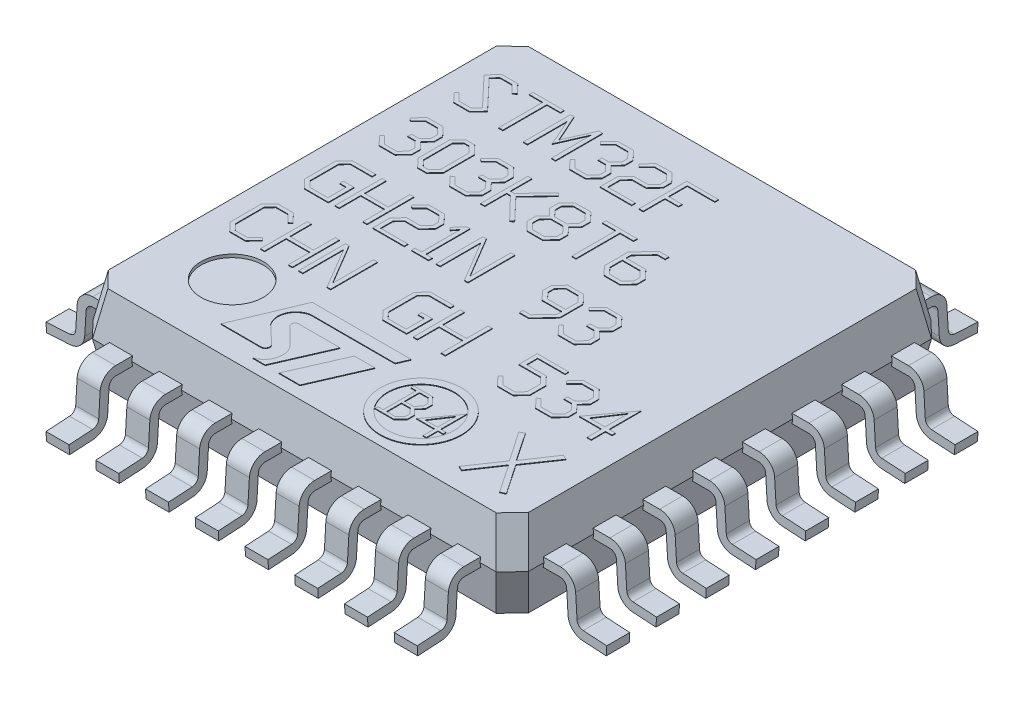
from build123d import *
from OCP.BRepFilletAPI import BRepFilletAPI_MakeChamfer

# Parameters (mm, degrees)
SKETCH1_W                  = 7
SKETCH1_H                  = 7
BOSS_EXTRUDE1_DEPTH        = 1.4
CHAMFER1_SIZE              = 0.7
CHAMFER1_SIZE_2            = 0.123428886
BOSS_EXTRUDE2_DEPTH        = 0.185
BOSS_EXTRUDE2_DEPTH_BACK   = 0.185
CHAMFER2_SIZE              = 0.25
CHAMFER2_SIZE2             = 0.257893718
FILLET2_R                  = 0.25
FILLET3_R                  = 0.105
LPATTERN2_COUNT            = 8
LPATTERN2_PITCH            = 0.8
SKETCH6_R                  = 0.5
PIN_1_IDENTIFICATION_DEPTH = 0.05
MARKINGS_1_DEPTH           = 0.01
MARKINGS_1_2_DEPTH         = 0.01
MARKINGS_1_3_DEPTH         = 0.01
MARKINGS_1_4_DEPTH         = 0.01
MARKINGS_1_5_DEPTH         = 0.01
MARKINGS_1_6_DEPTH         = 0.01
MARKINGS_1_7_DEPTH         = 0.01
MARKINGS_1_8_DEPTH         = 0.01
MARKINGS_1_9_DEPTH         = 0.01
MARKINGS_1_10_DEPTH        = 0.01
MARKINGS_1_11_DEPTH        = 0.01
MARKINGS_1_12_DEPTH        = 0.01
MARKINGS_1_13_DEPTH        = 0.01
MARKINGS_1_14_DEPTH        = 0.01
MARKINGS_1_15_DEPTH        = 0.01
MARKINGS_1_16_DEPTH        = 0.01
MARKINGS_1_17_DEPTH        = 0.01
MARKINGS_1_18_DEPTH        = 0.01
MARKINGS_1_19_DEPTH        = 0.01
MARKINGS_1_20_DEPTH        = 0.01
MARKINGS_1_21_DEPTH        = 0.01
MARKINGS_1_22_DEPTH        = 0.01
MARKINGS_1_23_DEPTH        = 0.01
MARKINGS_1_24_DEPTH        = 0.01
MARKINGS_1_25_DEPTH        = 0.01
MARKINGS_1_26_DEPTH        = 0.01
MARKINGS_1_27_DEPTH        = 0.01
MARKINGS_1_28_DEPTH        = 0.01
MARKINGS_2_DEPTH           = 0.01
MARKINGS_2_2_DEPTH         = 0.01
MARKINGS_2_3_DEPTH         = 0.01
MARKINGS_3_DEPTH           = 0.01
MARKINGS_3_2_DEPTH         = 0.01
SKETCH11_R                 = 0.653338309
SKETCH11_R_2               = 0.534659599
MARKINGS_4_DEPTH           = 0.01
MARKINGS_5_DEPTH           = 0.01


with BuildPart() as part:
    # Sketch1 → Boss-Extrude1 (new body)
    with BuildSketch(Plane(origin=(0, 0, 0), x_dir=(1, 0, 0), z_dir=(0, 1, 0))):
        with Locations((3.5, 3.5)):
            Rectangle(SKETCH1_W, SKETCH1_H)
    extrude(amount=BOSS_EXTRUDE1_DEPTH)

    # Chamfer1
    # the kernel refuses this chamfer: 0.7, 0.123428886 mm, written as the material it takes off along each edge
    with BuildSketch(Plane(origin=(8.818977157, 0, -7), x_dir=(0, 0.9999776716360547, -0.006682531656101123), z_dir=(-1, 0, 0)), Plane(origin=(0, 0, -8.818977157), x_dir=(-0.006682531656101709, 0.9999776716360547, 0), z_dir=(0, 0, 1)), Plane(origin=(-1.818977157, 0, 0), x_dir=(0, 0.9999776716360547, 0.006682531656101709), z_dir=(1, 0, 0)), Plane(origin=(7, 0, 1.818977157), x_dir=(0.006682531656101123, 0.9999776716360547, 0), z_dir=(0, 0, -1))) as chamfer1_piece_1:
        Polygon((CHAMFER1_SIZE * 0.999977671636, -CHAMFER1_SIZE * 0.0066825316561), (-CHAMFER1_SIZE_2 * 0.00668253168295, -CHAMFER1_SIZE_2 * 0.999977675654), (0, 0), align=None)
    extrude(amount=10.637954315, mode=Mode.SUBTRACT)
    with BuildSketch(Plane(origin=(8.818977157, 1.4, -7), x_dir=(0, -0.9999776716360547, -0.006682531656101123), z_dir=(-1, 0, 0)), Plane(origin=(0, 1.4, -8.818977157), x_dir=(-0.006682531656101709, -0.9999776716360547, 0), z_dir=(0, 0, 1)), Plane(origin=(-1.818977157, 1.4, 0), x_dir=(0, -0.9999776716360547, 0.006682531656101709), z_dir=(1, 0, 0)), Plane(origin=(7, 1.4, 1.818977157), x_dir=(0.006682531656101123, -0.9999776716360547, 0), z_dir=(0, 0, -1))) as chamfer1_piece_2:
        Polygon((CHAMFER1_SIZE * 0.999977671636, CHAMFER1_SIZE * 0.0066825316561), (-CHAMFER1_SIZE_2 * 0.00668253168295, CHAMFER1_SIZE_2 * 0.999977675654), (0, 0), align=None)
    extrude(amount=10.637954315, mode=Mode.SUBTRACT)

    # Chamfer2: one chamfer whose edges measure the first distance from different faces: ONE call of the kernel's chamfer builder (chamfer() names one face for all edges)
    chamfer2_edges_1 = [part.edges().sort_by_distance(p)[0] for p in [
        (6.938285557, 1.05, -0.061714443),
        (0.061714443, 1.05, -0.061714443),
    ]]
    chamfer2_side_1 = [part.faces().sort_by_distance(p)[0] for p in [
        (3.5, 1.047905928, -0.061345202),
    ]]
    chamfer2_edges_2 = [part.edges().sort_by_distance(p)[0] for p in [
        (6.938285557, 0.35, -0.061714443),
        (0.061714443, 0.35, -0.061714443),
    ]]
    chamfer2_side_2 = [part.faces().sort_by_distance(p)[0] for p in [
        (3.5, 0.352094072, -0.061345202),
    ]]
    chamfer2_edges_3 = [part.edges().sort_by_distance(p)[0] for p in [
        (6.938285557, 1.05, -6.938285557),
    ]]
    chamfer2_side_3 = [part.faces().sort_by_distance(p)[0] for p in [
        (6.938654798, 1.047905928, -3.5),
    ]]
    chamfer2_edges_4 = [part.edges().sort_by_distance(p)[0] for p in [
        (0.061714443, 1.05, -6.938285557),
    ]]
    chamfer2_side_4 = [part.faces().sort_by_distance(p)[0] for p in [
        (0.061345202, 1.047905928, -3.5),
    ]]
    chamfer2_edges_5 = [part.edges().sort_by_distance(p)[0] for p in [
        (6.938285557, 0.35, -6.938285557),
    ]]
    chamfer2_side_5 = [part.faces().sort_by_distance(p)[0] for p in [
        (6.938654798, 0.352094072, -3.5),
    ]]
    chamfer2_edges_6 = [part.edges().sort_by_distance(p)[0] for p in [
        (0.061714443, 0.35, -6.938285557),
    ]]
    chamfer2_side_6 = [part.faces().sort_by_distance(p)[0] for p in [
        (0.061345202, 0.352094072, -3.5),
    ]]
    chamfer2 = BRepFilletAPI_MakeChamfer(part.part.solid().wrapped)
    for e in chamfer2_edges_1:
        chamfer2.Add(CHAMFER2_SIZE, CHAMFER2_SIZE2, e.wrapped, chamfer2_side_1[0].wrapped)  # the first distance lies on this face
    for e in chamfer2_edges_2:
        chamfer2.Add(CHAMFER2_SIZE, CHAMFER2_SIZE2, e.wrapped, chamfer2_side_2[0].wrapped)  # the first distance lies on this face
    for e in chamfer2_edges_3:
        chamfer2.Add(CHAMFER2_SIZE, CHAMFER2_SIZE2, e.wrapped, chamfer2_side_3[0].wrapped)  # the first distance lies on this face
    for e in chamfer2_edges_4:
        chamfer2.Add(CHAMFER2_SIZE, CHAMFER2_SIZE2, e.wrapped, chamfer2_side_4[0].wrapped)  # the first distance lies on this face
    for e in chamfer2_edges_5:
        chamfer2.Add(CHAMFER2_SIZE, CHAMFER2_SIZE2, e.wrapped, chamfer2_side_5[0].wrapped)  # the first distance lies on this face
    for e in chamfer2_edges_6:
        chamfer2.Add(CHAMFER2_SIZE, CHAMFER2_SIZE2, e.wrapped, chamfer2_side_6[0].wrapped)  # the first distance lies on this face
    add(Compound.cast(chamfer2.Shape()), mode=Mode.REPLACE)

    # Sketch6 → Pin 1 Identification (cut)
    with BuildSketch(Plane(origin=(0, 1.4, 0), x_dir=(1, 0, 0), z_dir=(0, 1, 0))):
        with Locations(Location((1.25, 1.25, 0), (0, 0, 270))):
            Circle(SKETCH6_R)
    extrude(amount=-PIN_1_IDENTIFICATION_DEPTH, mode=Mode.SUBTRACT)


with BuildPart() as body_2:
    # Sketch4 → Boss-Extrude2 (new, two sides: drawn at the far end of the back side and taken through both)
    with BuildSketch(Plane.XY.offset(-0.7).offset(-BOSS_EXTRUDE2_DEPTH_BACK)):
        Polygon((6.987216294, 0.7725), (7.494151093, 0.7725), (7.536897924, 0.073595496), (8.008852038, 0.044729546), (8, -0.1), (7.4, -0.063302428), (7.357748714, 0.6275), (6.987216294, 0.6275), (7, 0.7), align=None)
    extrude(amount=BOSS_EXTRUDE2_DEPTH + BOSS_EXTRUDE2_DEPTH_BACK)

    # Fillet2
    fillet2_edges = [body_2.edges().sort_by_distance(p)[0] for p in [
        (7.494151093, 0.7725, -0.7),
        (7.4, -0.063302428, -0.7),
    ]]
    fillet(fillet2_edges, radius=FILLET2_R)

    # Fillet3
    fillet3_edges = [body_2.edges().sort_by_distance(p)[0] for p in [
        (7.536897924, 0.073595496, -0.7),
        (7.357748714, 0.6275, -0.7),
    ]]
    fillet(fillet3_edges, radius=FILLET3_R)


with BuildPart() as lpattern2_1:
    # LPattern2: pattern copy
    add(body_2.part.moved(Location(Vector(0, 0, -1) * (1 * LPATTERN2_PITCH))))


with BuildPart() as lpattern2_2:
    # LPattern2: pattern copy
    add(body_2.part.moved(Location(Vector(0, 0, -1) * (2 * LPATTERN2_PITCH))))


with BuildPart() as lpattern2_3:
    # LPattern2: pattern copy
    add(body_2.part.moved(Location(Vector(0, 0, -1) * (3 * LPATTERN2_PITCH))))


with BuildPart() as lpattern2_4:
    # LPattern2: pattern copy
    add(body_2.part.moved(Location(Vector(0, 0, -1) * (4 * LPATTERN2_PITCH))))


with BuildPart() as lpattern2_5:
    # LPattern2: pattern copy
    add(body_2.part.moved(Location(Vector(0, 0, -1) * (5 * LPATTERN2_PITCH))))


with BuildPart() as lpattern2_6:
    # LPattern2: pattern copy
    add(body_2.part.moved(Location(Vector(0, 0, -1) * (6 * LPATTERN2_PITCH))))


with BuildPart() as lpattern2_7:
    # LPattern2: pattern copy
    add(body_2.part.moved(Location(Vector(0, 0, -1) * (7 * LPATTERN2_PITCH))))


with BuildPart() as body_10:
    # Mirror1: mirrored copy
    add(body_2.part.mirror(Plane(origin=(0, 0, 0), x_dir=(-0.7071067811865477, 0, 0.7071067811865474), z_dir=(0.7071067811865476, 0, 0.7071067811865476))))


with BuildPart() as body_11:
    # Mirror1 2: mirrored copy
    add(lpattern2_1.part.mirror(Plane(origin=(0, 0, 0), x_dir=(-0.7071067811865477, 0, 0.7071067811865474), z_dir=(0.7071067811865476, 0, 0.7071067811865476))))


with BuildPart() as body_12:
    # Mirror1 3: mirrored copy
    add(lpattern2_2.part.mirror(Plane(origin=(0, 0, 0), x_dir=(-0.7071067811865477, 0, 0.7071067811865474), z_dir=(0.7071067811865476, 0, 0.7071067811865476))))


with BuildPart() as body_13:
    # Mirror1 4: mirrored copy
    add(lpattern2_3.part.mirror(Plane(origin=(0, 0, 0), x_dir=(-0.7071067811865477, 0, 0.7071067811865474), z_dir=(0.7071067811865476, 0, 0.7071067811865476))))


with BuildPart() as body_14:
    # Mirror1 5: mirrored copy
    add(lpattern2_4.part.mirror(Plane(origin=(0, 0, 0), x_dir=(-0.7071067811865477, 0, 0.7071067811865474), z_dir=(0.7071067811865476, 0, 0.7071067811865476))))


with BuildPart() as body_15:
    # Mirror1 6: mirrored copy
    add(lpattern2_5.part.mirror(Plane(origin=(0, 0, 0), x_dir=(-0.7071067811865477, 0, 0.7071067811865474), z_dir=(0.7071067811865476, 0, 0.7071067811865476))))


with BuildPart() as body_16:
    # Mirror1 7: mirrored copy
    add(lpattern2_6.part.mirror(Plane(origin=(0, 0, 0), x_dir=(-0.7071067811865477, 0, 0.7071067811865474), z_dir=(0.7071067811865476, 0, 0.7071067811865476))))


with BuildPart() as body_17:
    # Mirror1 8: mirrored copy
    add(lpattern2_7.part.mirror(Plane(origin=(0, 0, 0), x_dir=(-0.7071067811865477, 0, 0.7071067811865474), z_dir=(0.7071067811865476, 0, 0.7071067811865476))))


with BuildPart() as body_18:
    # Mirror2: mirrored copy
    add(body_2.part.mirror(Plane(origin=(3.5, 0, -3.5), x_dir=(0.7071067811865478, 0, 0.7071067811865472), z_dir=(0.7071067811865475, 0, -0.7071067811865477))))


with BuildPart() as body_19:
    # Mirror2 2: mirrored copy
    add(lpattern2_1.part.mirror(Plane(origin=(3.5, 0, -3.5), x_dir=(0.7071067811865478, 0, 0.7071067811865472), z_dir=(0.7071067811865475, 0, -0.7071067811865477))))


with BuildPart() as body_20:
    # Mirror2 3: mirrored copy
    add(lpattern2_2.part.mirror(Plane(origin=(3.5, 0, -3.5), x_dir=(0.7071067811865478, 0, 0.7071067811865472), z_dir=(0.7071067811865475, 0, -0.7071067811865477))))


with BuildPart() as body_21:
    # Mirror2 4: mirrored copy
    add(lpattern2_3.part.mirror(Plane(origin=(3.5, 0, -3.5), x_dir=(0.7071067811865478, 0, 0.7071067811865472), z_dir=(0.7071067811865475, 0, -0.7071067811865477))))


with BuildPart() as body_22:
    # Mirror2 5: mirrored copy
    add(lpattern2_4.part.mirror(Plane(origin=(3.5, 0, -3.5), x_dir=(0.7071067811865478, 0, 0.7071067811865472), z_dir=(0.7071067811865475, 0, -0.7071067811865477))))


with BuildPart() as body_23:
    # Mirror2 6: mirrored copy
    add(lpattern2_5.part.mirror(Plane(origin=(3.5, 0, -3.5), x_dir=(0.7071067811865478, 0, 0.7071067811865472), z_dir=(0.7071067811865475, 0, -0.7071067811865477))))


with BuildPart() as body_24:
    # Mirror2 7: mirrored copy
    add(lpattern2_6.part.mirror(Plane(origin=(3.5, 0, -3.5), x_dir=(0.7071067811865478, 0, 0.7071067811865472), z_dir=(0.7071067811865475, 0, -0.7071067811865477))))


with BuildPart() as body_25:
    # Mirror2 8: mirrored copy
    add(lpattern2_7.part.mirror(Plane(origin=(3.5, 0, -3.5), x_dir=(0.7071067811865478, 0, 0.7071067811865472), z_dir=(0.7071067811865475, 0, -0.7071067811865477))))


with BuildPart() as body_26:
    # Mirror2 9: mirrored copy
    add(body_17.part.mirror(Plane(origin=(3.5, 0, -3.5), x_dir=(0.7071067811865478, 0, 0.7071067811865472), z_dir=(0.7071067811865475, 0, -0.7071067811865477))))


with BuildPart() as body_27:
    # Mirror2 10: mirrored copy
    add(body_16.part.mirror(Plane(origin=(3.5, 0, -3.5), x_dir=(0.7071067811865478, 0, 0.7071067811865472), z_dir=(0.7071067811865475, 0, -0.7071067811865477))))


with BuildPart() as body_28:
    # Mirror2 11: mirrored copy
    add(body_15.part.mirror(Plane(origin=(3.5, 0, -3.5), x_dir=(0.7071067811865478, 0, 0.7071067811865472), z_dir=(0.7071067811865475, 0, -0.7071067811865477))))


with BuildPart() as body_29:
    # Mirror2 12: mirrored copy
    add(body_14.part.mirror(Plane(origin=(3.5, 0, -3.5), x_dir=(0.7071067811865478, 0, 0.7071067811865472), z_dir=(0.7071067811865475, 0, -0.7071067811865477))))


with BuildPart() as body_30:
    # Mirror2 13: mirrored copy
    add(body_13.part.mirror(Plane(origin=(3.5, 0, -3.5), x_dir=(0.7071067811865478, 0, 0.7071067811865472), z_dir=(0.7071067811865475, 0, -0.7071067811865477))))


with BuildPart() as body_31:
    # Mirror2 14: mirrored copy
    add(body_12.part.mirror(Plane(origin=(3.5, 0, -3.5), x_dir=(0.7071067811865478, 0, 0.7071067811865472), z_dir=(0.7071067811865475, 0, -0.7071067811865477))))


with BuildPart() as body_32:
    # Mirror2 15: mirrored copy
    add(body_11.part.mirror(Plane(origin=(3.5, 0, -3.5), x_dir=(0.7071067811865478, 0, 0.7071067811865472), z_dir=(0.7071067811865475, 0, -0.7071067811865477))))


with BuildPart() as body_33:
    # Mirror2 16: mirrored copy
    add(body_10.part.mirror(Plane(origin=(3.5, 0, -3.5), x_dir=(0.7071067811865478, 0, 0.7071067811865472), z_dir=(0.7071067811865475, 0, -0.7071067811865477))))


with BuildPart() as body_34:
    # Sketch7 → Markings 1 (new body)
    with BuildSketch(Plane(origin=(0, 1.4, 0), x_dir=(1, 0, 0), z_dir=(0, 1, 0))):
        Polygon((0.969664245, 5.636761835), (0.829876705, 5.488502324), (0.573599549, 5.488502324), (0.441224985, 5.630861712), (0.481315568, 5.669136872), (0.604007878, 5.547503558), (0.798863236, 5.547503558), (0.887516373, 5.636913121), (0.436686429, 6.114520548), (0.57390212, 6.263990341), (0.82972542, 6.263990341), (0.964671833, 6.120420671), (0.921101691, 6.082296797), (0.798863236, 6.204535251), (0.604159163, 6.204535251), (0.518985586, 6.114369262), align=None)
    extrude(amount=MARKINGS_1_DEPTH)


with BuildPart() as body_35:
    # Sketch7 → Markings 1 2 (new body)
    with BuildSketch(Plane(origin=(0, 1.4, 0), x_dir=(1, 0, 0), z_dir=(0, 1, 0))):
        Polygon((1.574714338, 6.204535251), (1.356863627, 6.204535251), (1.356863627, 5.496066584), (1.289844276, 5.496066584), (1.289844276, 6.204535251), (1.071993565, 6.204535251), (1.071993565, 6.263990341), (1.574714338, 6.263990341), align=None)
    extrude(amount=MARKINGS_1_2_DEPTH)


with BuildPart() as body_36:
    # Sketch7 → Markings 1 3 (new body)
    with BuildSketch(Plane(origin=(0, 1.4, 0), x_dir=(1, 0, 0), z_dir=(0, 1, 0))):
        Polygon((2.20321364, 5.496066584), (2.136043004, 5.496066584), (2.136043004, 6.138877467), (1.943608209, 5.701511908), (1.752383696, 6.138877467), (1.752383696, 5.496066584), (1.68521306, 5.496066584), (1.68521306, 6.255972225), (1.744063009, 6.255972225), (1.943608209, 5.81149626), (2.143153409, 6.255972225), (2.20321364, 6.255972225), align=None)
    extrude(amount=MARKINGS_1_3_DEPTH)


with BuildPart() as body_37:
    # Sketch7 → Markings 1 4 (new body)
    with BuildSketch(Plane(origin=(0, 1.4, 0), x_dir=(1, 0, 0), z_dir=(0, 1, 0))):
        Polygon((2.82384611, 5.627836008), (2.691774117, 5.488502324), (2.435496961, 5.488502324), (2.303122397, 5.630861712), (2.343212979, 5.669136872), (2.465905289, 5.547503558), (2.660760647, 5.547503558), (2.756675474, 5.648410797), (2.756675474, 5.744628194), (2.660609362, 5.845838004), (2.538824763, 5.845838004), (2.538824763, 5.90574695), (2.660911933, 5.90574695), (2.756675474, 6.007108044), (2.756675474, 6.103174156), (2.660760647, 6.204535251), (2.466056574, 6.204535251), (2.34381812, 6.082296797), (2.303122397, 6.120420671), (2.435648246, 6.263990341), (2.691471546, 6.263990341), (2.82384611, 6.123143805), (2.82384611, 5.98638197), (2.71885417, 5.875792477), (2.82384611, 5.764900413), align=None)
    extrude(amount=MARKINGS_1_4_DEPTH)


with BuildPart() as body_38:
    # Sketch7 → Markings 1 5 (new body)
    with BuildSketch(Plane(origin=(0, 1.4, 0), x_dir=(1, 0, 0), z_dir=(0, 1, 0))):
        Polygon((3.444478581, 5.98638197), (3.312255302, 5.845838004), (3.08684033, 5.845838004), (2.993648637, 5.747653899), (2.993648637, 5.547503558), (3.436611749, 5.547503558), (3.436611749, 5.488502324), (2.926478001, 5.488502324), (2.926478001, 5.768077403), (3.056432001, 5.90574695), (3.281544403, 5.90574695), (3.377307945, 6.007108044), (3.377307945, 6.103174156), (3.281393118, 6.204535251), (3.086689045, 6.204535251), (2.963845449, 6.082296797), (2.923754867, 6.120571956), (3.056280716, 6.263990341), (3.312104017, 6.263990341), (3.444478581, 6.123143805), align=None)
    extrude(amount=MARKINGS_1_5_DEPTH)


with BuildPart() as body_39:
    # Sketch7 → Markings 1 6 (new body)
    with BuildSketch(Plane(origin=(0, 1.4, 0), x_dir=(1, 0, 0), z_dir=(0, 1, 0))):
        Polygon((4.05724422, 6.204535251), (3.614281107, 6.204535251), (3.614281107, 5.90574695), (3.832131818, 5.90574695), (3.832131818, 5.845838004), (3.614281107, 5.845838004), (3.614281107, 5.496066584), (3.547110471, 5.496066584), (3.547110471, 6.263990341), (4.05724422, 6.263990341), align=None)
    extrude(amount=MARKINGS_1_6_DEPTH)


with BuildPart() as body_40:
    # Sketch7 → Markings 1 7 (new body)
    with BuildSketch(Plane(origin=(0, 1.4, 0), x_dir=(1, 0, 0), z_dir=(0, 1, 0))):
        Polygon((0.961948699, 4.427836008), (0.829876705, 4.288502324), (0.573599549, 4.288502324), (0.441224985, 4.430861712), (0.481315568, 4.469136872), (0.604007878, 4.347503558), (0.798863236, 4.347503558), (0.894778063, 4.448410797), (0.894778063, 4.544628194), (0.798711951, 4.645838004), (0.676927352, 4.645838004), (0.676927352, 4.70574695), (0.799014521, 4.70574695), (0.894778063, 4.807108044), (0.894778063, 4.903174156), (0.798863236, 5.004535251), (0.604159163, 5.004535251), (0.481920708, 4.882296797), (0.441224985, 4.920420671), (0.573750835, 5.063990341), (0.829574135, 5.063990341), (0.961948699, 4.923143805), (0.961948699, 4.78638197), (0.856956759, 4.675792477), (0.961948699, 4.564900413), align=None)
    extrude(amount=MARKINGS_1_7_DEPTH)


with BuildPart() as body_41:
    # Sketch7 → Markings 1 8 (new body)
    with BuildSketch(Plane(origin=(0, 1.4, 0), x_dir=(1, 0, 0), z_dir=(0, 1, 0))):
        Polygon((1.469722398, 4.427836008), (1.337347834, 4.288502324), (1.19423202, 4.288502324), (1.06458059, 4.424810303), (1.06458059, 4.926320795), (1.19453459, 5.063990341), (1.337045264, 5.063990341), (1.469722398, 4.92329509), align=None)
        Polygon((1.402551762, 4.448259512), (1.402551762, 4.903174156), (1.307242076, 5.004535251), (1.224337778, 5.004535251), (1.131751226, 4.906351146), (1.131751226, 4.445233807), (1.224186493, 4.347503558), (1.307393361, 4.347503558), align=None, mode=Mode.SUBTRACT)
    extrude(amount=MARKINGS_1_8_DEPTH)


with BuildPart() as body_42:
    # Sketch7 → Markings 1 9 (new body)
    with BuildSketch(Plane(origin=(0, 1.4, 0), x_dir=(1, 0, 0), z_dir=(0, 1, 0))):
        Polygon((2.096708848, 4.427836008), (1.964636854, 4.288502324), (1.708359698, 4.288502324), (1.575985134, 4.430861712), (1.616075716, 4.469136872), (1.738768027, 4.347503558), (1.933623385, 4.347503558), (2.029538212, 4.448410797), (2.029538212, 4.544628194), (1.9334721, 4.645838004), (1.811687501, 4.645838004), (1.811687501, 4.70574695), (1.93377467, 4.70574695), (2.029538212, 4.807108044), (2.029538212, 4.903174156), (1.933623385, 5.004535251), (1.738919312, 5.004535251), (1.616680857, 4.882296797), (1.575985134, 4.920420671), (1.708510983, 5.063990341), (1.964334284, 5.063990341), (2.096708848, 4.923143805), (2.096708848, 4.78638197), (1.991716908, 4.675792477), (2.096708848, 4.564900413), align=None)
    extrude(amount=MARKINGS_1_9_DEPTH)


with BuildPart() as body_43:
    # Sketch7 → Markings 1 10 (new body)
    with BuildSketch(Plane(origin=(0, 1.4, 0), x_dir=(1, 0, 0), z_dir=(0, 1, 0))):
        Polygon((2.719610596, 4.323600494), (2.676645595, 4.285476619), (2.329143454, 4.645838004), (2.266511374, 4.645838004), (2.266511374, 4.296066584), (2.199340738, 4.296066584), (2.199340738, 5.055972225), (2.266511374, 5.055972225), (2.266511374, 4.70574695), (2.329294739, 4.70574695), (2.676645595, 5.067016045), (2.719610596, 5.028135745), (2.38617798, 4.675943762), align=None)
    extrude(amount=MARKINGS_1_10_DEPTH)


with BuildPart() as body_44:
    # Sketch7 → Markings 1 11 (new body)
    with BuildSketch(Plane(origin=(0, 1.4, 0), x_dir=(1, 0, 0), z_dir=(0, 1, 0))):
        Polygon((3.337973789, 4.427836008), (3.205447939, 4.288502324), (2.949624639, 4.288502324), (2.819973209, 4.424810303), (2.819973209, 4.568077403), (2.925116434, 4.675792477), (2.819973209, 4.783356265), (2.819973209, 4.926320795), (2.949927209, 5.063990341), (3.205145369, 5.063990341), (3.337973789, 4.92329509), (3.337973789, 4.786230684), (3.232527993, 4.675792477), (3.337973789, 4.565051699), align=None)
        Polygon((3.270803153, 4.807108044), (3.270803153, 4.903174156), (3.174888326, 5.004535251), (2.979730397, 5.004535251), (2.887143845, 4.906351146), (2.887143845, 4.80408234), (2.979579112, 4.70574695), (3.175039611, 4.70574695), align=None, mode=Mode.SUBTRACT)
        Polygon((3.270803153, 4.448410797), (3.270803153, 4.544628194), (3.17473704, 4.645838004), (2.979730397, 4.645838004), (2.887143845, 4.547805184), (2.887143845, 4.445233807), (2.979579112, 4.347503558), (3.174888326, 4.347503558), align=None, mode=Mode.SUBTRACT)
    extrude(amount=MARKINGS_1_11_DEPTH)


with BuildPart() as body_45:
    # Sketch7 → Markings 1 12 (new body)
    with BuildSketch(Plane(origin=(0, 1.4, 0), x_dir=(1, 0, 0), z_dir=(0, 1, 0))):
        Polygon((3.950739428, 5.004535251), (3.732888717, 5.004535251), (3.732888717, 4.296066584), (3.665869366, 4.296066584), (3.665869366, 5.004535251), (3.448018655, 5.004535251), (3.448018655, 5.063990341), (3.950739428, 5.063990341), align=None)
    extrude(amount=MARKINGS_1_12_DEPTH)


with BuildPart() as body_46:
    # Sketch7 → Markings 1 13 (new body)
    with BuildSketch(Plane(origin=(0, 1.4, 0), x_dir=(1, 0, 0), z_dir=(0, 1, 0))):
        Polygon((4.579238729, 4.427836008), (4.44671288, 4.288502324), (4.19088958, 4.288502324), (4.06123815, 4.424810303), (4.06123815, 4.807108044), (4.304050921, 5.063990341), (4.458664412, 5.063990341), (4.458664412, 5.004535251), (4.333854109, 5.004535251), (4.128408786, 4.786533255), (4.128408786, 4.70574695), (4.44641031, 4.70574695), (4.579238729, 4.565051699), align=None)
        Polygon((4.512068094, 4.448410797), (4.512068094, 4.544628194), (4.416001981, 4.645838004), (4.128408786, 4.645838004), (4.128408786, 4.445233807), (4.220844053, 4.347503558), (4.416153267, 4.347503558), align=None, mode=Mode.SUBTRACT)
    extrude(amount=MARKINGS_1_13_DEPTH)


with BuildPart() as body_47:
    # Sketch7 → Markings 1 14 (new body)
    with BuildSketch(Plane(origin=(0, 1.4, 0), x_dir=(1, 0, 0), z_dir=(0, 1, 0))):
        Polygon((0.958009115, 3.088576343), (0.572160067, 3.088576343), (0.443343303, 3.224006803), (0.443343303, 3.722288686), (0.57246069, 3.859071948), (0.950192929, 3.859071948), (0.950192929, 3.799999617), (0.602072011, 3.799999617), (0.51008151, 3.702447598), (0.51008151, 3.244298826), (0.6019217, 3.147197741), (0.891270908, 3.147197741), (0.891270908, 3.443611579), (0.786503948, 3.443611579), (0.786503948, 3.503134845), (0.958009115, 3.503134845), align=None)
    extrude(amount=MARKINGS_1_14_DEPTH)


with BuildPart() as body_48:
    # Sketch7 → Markings 1 15 (new body)
    with BuildSketch(Plane(origin=(0, 1.4, 0), x_dir=(1, 0, 0), z_dir=(0, 1, 0))):
        Polygon((1.572722113, 3.096091907), (1.505983906, 3.096091907), (1.505983906, 3.443611579), (1.124794508, 3.443611579), (1.124794508, 3.096091907), (1.058056301, 3.096091907), (1.058056301, 3.851105451), (1.124794508, 3.851105451), (1.124794508, 3.503134845), (1.505983906, 3.503134845), (1.505983906, 3.851105451), (1.572722113, 3.851105451), align=None)
    extrude(amount=MARKINGS_1_15_DEPTH)


with BuildPart() as body_49:
    # Sketch7 → Markings 1 16 (new body)
    with BuildSketch(Plane(origin=(0, 1.4, 0), x_dir=(1, 0, 0), z_dir=(0, 1, 0))):
        Polygon((2.187435111, 3.583250755), (2.056063055, 3.443611579), (1.832099253, 3.443611579), (1.739507506, 3.34605956), (1.739507506, 3.147197741), (2.179618925, 3.147197741), (2.179618925, 3.088576343), (1.672769299, 3.088576343), (1.672769299, 3.366351583), (1.801886686, 3.503134845), (2.025549866, 3.503134845), (2.120696904, 3.6038434), (2.120696904, 3.699291061), (2.025399555, 3.799999617), (1.831948941, 3.799999617), (1.709896185, 3.678548105), (1.670063696, 3.716576858), (1.801736375, 3.859071948), (2.055912744, 3.859071948), (2.187435111, 3.71913215), align=None)
    extrude(amount=MARKINGS_1_16_DEPTH)


with BuildPart() as body_50:
    # Sketch7 → Markings 1 17 (new body)
    with BuildSketch(Plane(origin=(0, 1.4, 0), x_dir=(1, 0, 0), z_dir=(0, 1, 0))):
        Polygon((2.570668743, 3.088576343), (2.29484755, 3.088576343), (2.29484755, 3.147197741), (2.39961451, 3.147197741), (2.39961451, 3.771741097), (2.324609183, 3.678548105), (2.284776694, 3.716576858), (2.415998439, 3.859071948), (2.465901783, 3.859071948), (2.465901783, 3.147197741), (2.570668743, 3.147197741), align=None)
    extrude(amount=MARKINGS_1_17_DEPTH)


with BuildPart() as body_51:
    # Sketch7 → Markings 1 18 (new body)
    with BuildSketch(Plane(origin=(0, 1.4, 0), x_dir=(1, 0, 0), z_dir=(0, 1, 0))):
        Polygon((3.195602908, 3.096091907), (3.137432444, 3.096091907), (2.747675303, 3.754304988), (2.747675303, 3.096091907), (2.680937096, 3.096091907), (2.680937096, 3.849752649), (2.737604447, 3.851105451), (3.128864701, 3.192892369), (3.128864701, 3.851105451), (3.195602908, 3.851105451), align=None)
    extrude(amount=MARKINGS_1_18_DEPTH)


with BuildPart() as body_52:
    # Sketch7 → Markings 1 19 (new body)
    with BuildSketch(Plane(origin=(0, 1.4, 0), x_dir=(1, 0, 0), z_dir=(0, 1, 0))):
        Polygon((4.425028904, 3.346209872), (4.181224013, 3.088576343), (4.029860557, 3.088576343), (4.029860557, 3.147197741), (4.151612691, 3.147197741), (4.358290697, 3.366351583), (4.358290697, 3.443611579), (4.039330167, 3.443611579), (3.910363092, 3.58024453), (3.910363092, 3.722288686), (4.039480479, 3.859071948), (4.293055603, 3.859071948), (4.425028904, 3.719282461), align=None)
        Polygon((4.358290697, 3.503134845), (4.358290697, 3.699291061), (4.262993347, 3.799999617), (4.0690918, 3.799999617), (3.977101299, 3.702447598), (3.977101299, 3.600837175), (4.068941489, 3.503134845), align=None, mode=Mode.SUBTRACT)
    extrude(amount=MARKINGS_1_19_DEPTH)


with BuildPart() as body_53:
    # Sketch7 → Markings 1 20 (new body)
    with BuildSketch(Plane(origin=(0, 1.4, 0), x_dir=(1, 0, 0), z_dir=(0, 1, 0))):
        Polygon((5.039741902, 3.227013029), (4.908520157, 3.088576343), (4.653892854, 3.088576343), (4.522370487, 3.230019255), (4.562202975, 3.268048008), (4.684105421, 3.147197741), (4.877706346, 3.147197741), (4.973003695, 3.247455363), (4.973003695, 3.343053335), (4.877556034, 3.443611579), (4.756555456, 3.443611579), (4.756555456, 3.503134845), (4.877856657, 3.503134845), (4.973003695, 3.6038434), (4.973003695, 3.699291061), (4.877706346, 3.799999617), (4.684255732, 3.799999617), (4.56280422, 3.678548105), (4.522370487, 3.716426547), (4.654043165, 3.859071948), (4.908219535, 3.859071948), (5.039741902, 3.71913215), (5.039741902, 3.583250755), (4.935425876, 3.473373212), (5.039741902, 3.363195046), align=None)
    extrude(amount=MARKINGS_1_20_DEPTH)


with BuildPart() as body_54:
    # Sketch7 → Markings 1 21 (new body)
    with BuildSketch(Plane(origin=(0, 1.4, 0), x_dir=(1, 0, 0), z_dir=(0, 1, 0))):
        Polygon((0.960263784, 2.030169566), (0.826336437, 1.888576343), (0.572160067, 1.888576343), (0.443343303, 2.024006803), (0.443343303, 2.522288686), (0.57246069, 2.659071948), (0.826186125, 2.659071948), (0.960263784, 2.516426547), (0.917575382, 2.478548105), (0.795973559, 2.599999617), (0.602072011, 2.599999617), (0.51008151, 2.502447598), (0.51008151, 2.044298826), (0.6019217, 1.947197741), (0.79612387, 1.947197741), (0.917575382, 2.068048008), align=None)
    extrude(amount=MARKINGS_1_21_DEPTH)


with BuildPart() as body_55:
    # Sketch7 → Markings 1 22 (new body)
    with BuildSketch(Plane(origin=(0, 1.4, 0), x_dir=(1, 0, 0), z_dir=(0, 1, 0))):
        Polygon((1.572722113, 1.896091907), (1.505983906, 1.896091907), (1.505983906, 2.243611579), (1.124794508, 2.243611579), (1.124794508, 1.896091907), (1.058056301, 1.896091907), (1.058056301, 2.651105451), (1.124794508, 2.651105451), (1.124794508, 2.303134845), (1.505983906, 2.303134845), (1.505983906, 2.651105451), (1.572722113, 2.651105451), align=None)
    extrude(amount=MARKINGS_1_22_DEPTH)


with BuildPart() as body_56:
    # Sketch7 → Markings 1 23 (new body)
    with BuildSketch(Plane(origin=(0, 1.4, 0), x_dir=(1, 0, 0), z_dir=(0, 1, 0))):
        Polygon((2.187435111, 1.896091907), (2.129264647, 1.896091907), (1.739507506, 2.554304988), (1.739507506, 1.896091907), (1.672769299, 1.896091907), (1.672769299, 2.649752649), (1.729436651, 2.651105451), (2.120696904, 1.992892369), (2.120696904, 2.651105451), (2.187435111, 2.651105451), align=None)
    extrude(amount=MARKINGS_1_23_DEPTH)


with BuildPart() as body_57:
    # Sketch7 → Markings 1 24 (new body)
    with BuildSketch(Plane(origin=(0, 1.4, 0), x_dir=(1, 0, 0), z_dir=(0, 1, 0))):
        Polygon((3.416861107, 1.888576343), (3.03101206, 1.888576343), (2.902195295, 2.024006803), (2.902195295, 2.522288686), (3.031312682, 2.659071948), (3.409044921, 2.659071948), (3.409044921, 2.599999617), (3.060924004, 2.599999617), (2.968933502, 2.502447598), (2.968933502, 2.044298826), (3.060773692, 1.947197741), (3.3501229, 1.947197741), (3.3501229, 2.243611579), (3.24535594, 2.243611579), (3.24535594, 2.303134845), (3.416861107, 2.303134845), align=None)
    extrude(amount=MARKINGS_1_24_DEPTH)


with BuildPart() as body_58:
    # Sketch7 → Markings 1 25 (new body)
    with BuildSketch(Plane(origin=(0, 1.4, 0), x_dir=(1, 0, 0), z_dir=(0, 1, 0))):
        Polygon((4.031574105, 1.896091907), (3.964835899, 1.896091907), (3.964835899, 2.243611579), (3.5836465, 2.243611579), (3.5836465, 1.896091907), (3.516908293, 1.896091907), (3.516908293, 2.651105451), (3.5836465, 2.651105451), (3.5836465, 2.303134845), (3.964835899, 2.303134845), (3.964835899, 2.651105451), (4.031574105, 2.651105451), align=None)
    extrude(amount=MARKINGS_1_25_DEPTH)


with BuildPart() as body_59:
    # Sketch7 → Markings 1 26 (new body)
    with BuildSketch(Plane(origin=(0, 1.4, 0), x_dir=(1, 0, 0), z_dir=(0, 1, 0))):
        Polygon((5.261000102, 2.027013029), (5.129778357, 1.888576343), (4.875151054, 1.888576343), (4.743628686, 2.030019255), (4.783461175, 2.068048008), (4.90536362, 1.947197741), (5.098964545, 1.947197741), (5.194261895, 2.047455363), (5.194261895, 2.262099866), (5.098814234, 2.362507799), (4.746334289, 2.362507799), (4.746334289, 2.659071948), (5.253183915, 2.659071948), (5.253183915, 2.599999617), (4.813072496, 2.599999617), (4.813072496, 2.422181376), (5.129477734, 2.422181376), (5.261000102, 2.282091266), align=None)
    extrude(amount=MARKINGS_1_26_DEPTH)


with BuildPart() as body_60:
    # Sketch7 → Markings 1 27 (new body)
    with BuildSketch(Plane(origin=(0, 1.4, 0), x_dir=(1, 0, 0), z_dir=(0, 1, 0))):
        Polygon((5.8757131, 2.027013029), (5.744491355, 1.888576343), (5.489864052, 1.888576343), (5.358341685, 2.030019255), (5.398174173, 2.068048008), (5.520076619, 1.947197741), (5.713677543, 1.947197741), (5.808974893, 2.047455363), (5.808974893, 2.143053335), (5.713527232, 2.243611579), (5.592526654, 2.243611579), (5.592526654, 2.303134845), (5.713827854, 2.303134845), (5.808974893, 2.4038434), (5.808974893, 2.499291061), (5.713677543, 2.599999617), (5.52022693, 2.599999617), (5.398775418, 2.478548105), (5.358341685, 2.516426547), (5.490014363, 2.659071948), (5.744190732, 2.659071948), (5.8757131, 2.51913215), (5.8757131, 2.383250755), (5.771397074, 2.273373212), (5.8757131, 2.163195046), align=None)
    extrude(amount=MARKINGS_1_27_DEPTH)


with BuildPart() as body_61:
    # Sketch7 → Markings 1 28 (new body)
    with BuildSketch(Plane(origin=(0, 1.4, 0), x_dir=(1, 0, 0), z_dir=(0, 1, 0))):
        Polygon((6.482609911, 2.125617227), (6.378293885, 2.125617227), (6.378293885, 1.896091907), (6.311555678, 1.896091907), (6.311555678, 2.125617227), (5.956670753, 2.125617227), (6.378293885, 2.698904437), (6.378293885, 2.184088313), (6.482609911, 2.184088313), align=None)
        Polygon((6.311555678, 2.184088313), (6.311555678, 2.560167128), (6.061137091, 2.184088313), align=None, mode=Mode.SUBTRACT)
    extrude(amount=MARKINGS_1_28_DEPTH)


with BuildPart() as body_62:
    # Sketch8 → Markings 2 (new body)
    with BuildSketch(Plane(origin=(0, 1.4, 0), x_dir=(1, 0, 0), z_dir=(0, 1, 0))):
        with BuildLine():
            Line((2.222018243, 1.565672254), (3.813871342, 1.565672254))
            Line((3.813871342, 1.565672254), (3.737180503, 1.38327242))
            Line((3.737180503, 1.38327242), (2.383690824, 1.38327242))
            ThreePointArc((2.383690824, 1.38327242), (2.159026235, 1.204940687), (2.198483552, 0.920828906))
            Line((2.198483552, 0.920828906), (2.485121103, 0.649303551))
            ThreePointArc((2.485121103, 0.649303551), (2.495234863, 0.576572113), (2.436187091, 0.532919954))
            Line((2.436187091, 0.532919954), (1.787792845, 0.532919954))
            Line((1.787792845, 0.532919954), (2.222018243, 1.565672254))
        make_face()
    extrude(amount=MARKINGS_2_DEPTH)


with BuildPart() as body_63:
    # Sketch8 → Markings 2 2 (new body)
    with BuildSketch(Plane(origin=(0, 1.4, 0), x_dir=(1, 0, 0), z_dir=(0, 1, 0))):
        with BuildLine():
            Line((2.409045558, 1.155970238), (3.080181649, 1.155970238))
            Line((3.080181649, 1.155970238), (2.715004658, 0.314582712))
            Line((2.715004658, 0.314582712), (2.522546515, 0.314582712))
            ThreePointArc((2.522546515, 0.314582712), (2.704873622, 0.506742599), (2.662766814, 0.768268149))
            Line((2.662766814, 0.768268149), (2.367733222, 1.063301741))
            ThreePointArc((2.367733222, 1.063301741), (2.360557147, 1.122043819), (2.409045558, 1.155970238))
        make_face()
    extrude(amount=MARKINGS_2_2_DEPTH)


with BuildPart() as body_64:
    # Sketch8 → Markings 2 3 (new body)
    with BuildSketch(Plane(origin=(0, 1.4, 0), x_dir=(1, 0, 0), z_dir=(0, 1, 0))):
        Polygon((3.309650974, 1.155970238), (3.640284196, 1.155970238), (3.275107205, 0.314582712), (2.93953916, 0.314582712), align=None)
    extrude(amount=MARKINGS_2_3_DEPTH)


with BuildPart() as body_65:
    # Sketch9 → Markings 3 (new body)
    with BuildSketch(Plane(origin=(0, 1.4, 0), x_dir=(1, 0, 0), z_dir=(0, 1, 0))):
        Polygon((4.614596577, 0.706164378), (4.50795609, 0.594045784), (4.203738537, 0.594045784), (4.203738537, 0.641522713), (4.288588331, 0.641522713), (4.288588331, 1.170220926), (4.203738537, 1.170220926), (4.203738537, 1.218063063), (4.507712619, 1.218063063), (4.614596577, 1.104848847), (4.614596577, 0.994556289), (4.529746783, 0.905689216), (4.614596577, 0.816578672), align=None)
        Polygon((4.560545919, 1.011355817), (4.560545919, 1.088657997), (4.483365476, 1.170220926), (4.342273781, 1.170220926), (4.342273781, 0.929792888), (4.483487211, 0.929792888), align=None, mode=Mode.SUBTRACT)
        Polygon((4.560545919, 0.722720435), (4.560545919, 0.800144351), (4.48324374, 0.881585544), (4.342273781, 0.881585544), (4.342273781, 0.641522713), (4.483365476, 0.641522713), align=None, mode=Mode.SUBTRACT)
    extrude(amount=MARKINGS_3_DEPTH)


with BuildPart() as body_66:
    # Sketch9 → Markings 3 2 (new body)
    with BuildSketch(Plane(origin=(0, 1.4, 0), x_dir=(1, 0, 0), z_dir=(0, 1, 0))):
        Polygon((5.10767492, 0.786023008), (5.023190333, 0.786023008), (5.023190333, 0.60013257), (4.969139676, 0.60013257), (4.969139676, 0.786023008), (4.681721651, 0.786023008), (5.023190333, 1.250323027), (5.023190333, 0.833378201), (5.10767492, 0.833378201), align=None)
        Polygon((4.969139676, 0.833378201), (4.969139676, 1.137960962), (4.766327973, 0.833378201), align=None, mode=Mode.SUBTRACT)
    extrude(amount=MARKINGS_3_2_DEPTH)


with BuildPart() as body_67:
    # Sketch11 → Markings 4 (new body)
    with BuildSketch(Plane(origin=(0, 1.4, 0), x_dir=(1, 0, 0), z_dir=(0, 1, 0))):
        with Locations(Location((4.613667567, 0.922645422, 0), (0, 0, 270))):
            Circle(SKETCH11_R)
        with Locations(Location((4.613667567, 0.922645422, 0), (0, 0, 270))):
            Circle(SKETCH11_R_2, mode=Mode.SUBTRACT)
    extrude(amount=MARKINGS_4_DEPTH)


with BuildPart() as body_68:
    # Sketch12 → Markings 5 (new body)
    with BuildSketch(Plane(origin=(0, 1.4, 0), x_dir=(1, 0, 0), z_dir=(0, 1, 0))):
        Polygon((6.446951898, 0.463269227), (6.369992524, 0.428998255), (6.06656416, 0.881134576), (5.76012957, 0.42839701), (5.688781817, 0.462467566), (6.01485708, 0.941459502), (5.688781817, 1.420651853), (5.76012957, 1.455724484), (6.06656416, 1.001784428), (6.370192939, 1.455724484), (6.446951898, 1.419850193), (6.120275389, 0.941659917), align=None)
    extrude(amount=MARKINGS_5_DEPTH)


solid = Compound([part.part, body_2.part, lpattern2_1.part, lpattern2_2.part, lpattern2_3.part, lpattern2_4.part, lpattern2_5.part, lpattern2_6.part, lpattern2_7.part, body_10.part, body_11.part, body_12.part, body_13.part, body_14.part, body_15.part, body_16.part, body_17.part, body_18.part, body_19.part, body_20.part, body_21.part, body_22.part, body_23.part, body_24.part, body_25.part, body_26.part, body_27.part, body_28.part, body_29.part, body_30.part, body_31.part, body_32.part, body_33.part, body_34.part, body_35.part, body_36.part, body_37.part, body_38.part, body_39.part, body_40.part, body_41.part, body_42.part, body_43.part, body_44.part, body_45.part, body_46.part, body_47.part, body_48.part, body_49.part, body_50.part, body_51.part, body_52.part, body_53.part, body_54.part, body_55.part, body_56.part, body_57.part, body_58.part, body_59.part, body_60.part, body_61.part, body_62.part, body_63.part, body_64.part, body_65.part, body_66.part, body_67.part, body_68.part])
